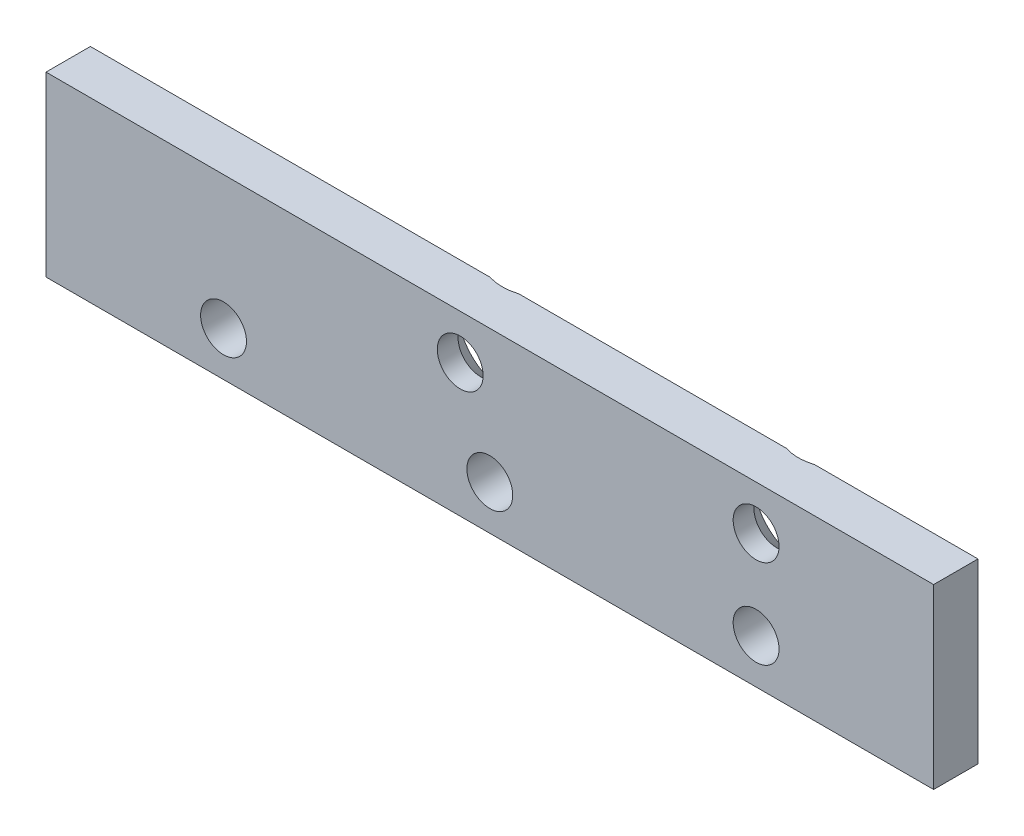
from build123d import *

# Parameters (mm, degrees)
SKETCH_1_W      = 60
SKETCH_1_H      = 12
SKETCH_1_R      = 1.55
EXTRUDE_1_DEPTH = 3
CHAMFER_1_SIZE  = 1.6


with BuildPart() as part:
    # 草图1 → 凸台-拉伸1 (new body)
    with BuildSketch(Plane.XY):
        Rectangle(SKETCH_1_W, SKETCH_1_H)
        with Locations((18, 3)):
            Circle(SKETCH_1_R, mode=Mode.SUBTRACT)
        with Locations((-2, 3)):
            Circle(SKETCH_1_R, mode=Mode.SUBTRACT)
        with Locations((0, -3)):
            Circle(SKETCH_1_R, mode=Mode.SUBTRACT)
        with Locations((18, -3)):
            Circle(SKETCH_1_R, mode=Mode.SUBTRACT)
        with Locations((-18, -3)):
            Circle(SKETCH_1_R, mode=Mode.SUBTRACT)
    extrude(amount=EXTRUDE_1_DEPTH)

    # 倒角1
    # the kernel refuses this chamfer: 1.6 mm, written as the material it takes off along each edge
    with BuildSketch(Plane(origin=(18, 3, 0), x_dir=(1, 0, 0), z_dir=(0, -1, 0))) as chamfer_1_piece_1:
        Polygon((1.55, CHAMFER_1_SIZE), (1.55 + CHAMFER_1_SIZE, 0), (1.55, 0), align=None)
    revolve(axis=Axis((18, 3, 0), (0, 0, 1)), mode=Mode.SUBTRACT)
    with BuildSketch(Plane(origin=(-2, 3, 0), x_dir=(1, 0, 0), z_dir=(0, -1, 0))) as chamfer_1_piece_2:
        Polygon((1.55, CHAMFER_1_SIZE), (1.55 + CHAMFER_1_SIZE, 0), (1.55, 0), align=None)
    revolve(axis=Axis((-2, 3, 0), (0, 0, 1)), mode=Mode.SUBTRACT)


solid = part.part
